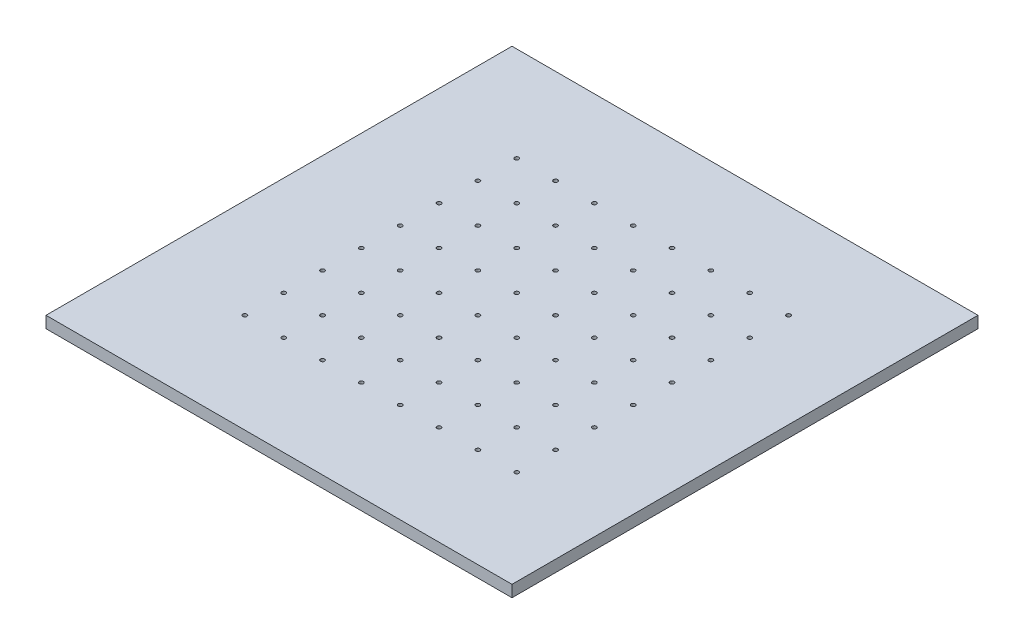
from build123d import *

# Parameters (mm, degrees)
SKETCH3_W                  = 600
SKETCH3_H                  = 600
BOSS_EXTRUDE1_DEPTH        = 15
SKETCH5_R                  = 2.65
CUT_EXTRUDE1_DEPTH         = 8.5
CUT_EXTRUDE1_DRAFT         = -1
LPATTERN1_COPY_1_SKETCH_R  = 2.65
LPATTERN1_COPY_1_DEPTH     = 8.5
LPATTERN1_COPY_1_DRAFT     = -1
LPATTERN1_COPY_2_SKETCH_R  = 2.65
LPATTERN1_COPY_2_DEPTH     = 8.5
LPATTERN1_COPY_2_DRAFT     = -1
LPATTERN1_COPY_3_SKETCH_R  = 2.65
LPATTERN1_COPY_3_DEPTH     = 8.5
LPATTERN1_COPY_3_DRAFT     = -1
LPATTERN1_COPY_4_SKETCH_R  = 2.65
LPATTERN1_COPY_4_DEPTH     = 8.5
LPATTERN1_COPY_4_DRAFT     = -1
LPATTERN1_COPY_5_SKETCH_R  = 2.65
LPATTERN1_COPY_5_DEPTH     = 8.5
LPATTERN1_COPY_5_DRAFT     = -1
LPATTERN1_COPY_6_SKETCH_R  = 2.65
LPATTERN1_COPY_6_DEPTH     = 8.5
LPATTERN1_COPY_6_DRAFT     = -1
LPATTERN1_COPY_7_SKETCH_R  = 2.65
LPATTERN1_COPY_7_DEPTH     = 8.5
LPATTERN1_COPY_7_DRAFT     = -1
LPATTERN1_COPY_8_SKETCH_R  = 2.65
LPATTERN1_COPY_8_DEPTH     = 8.5
LPATTERN1_COPY_8_DRAFT     = -1
LPATTERN1_COPY_9_SKETCH_R  = 2.65
LPATTERN1_COPY_9_DEPTH     = 8.5
LPATTERN1_COPY_9_DRAFT     = -1
LPATTERN1_COPY_10_SKETCH_R = 2.65
LPATTERN1_COPY_10_DEPTH    = 8.5
LPATTERN1_COPY_10_DRAFT    = -1
LPATTERN1_COPY_11_SKETCH_R = 2.65
LPATTERN1_COPY_11_DEPTH    = 8.5
LPATTERN1_COPY_11_DRAFT    = -1
LPATTERN1_COPY_12_SKETCH_R = 2.65
LPATTERN1_COPY_12_DEPTH    = 8.5
LPATTERN1_COPY_12_DRAFT    = -1
LPATTERN1_COPY_13_SKETCH_R = 2.65
LPATTERN1_COPY_13_DEPTH    = 8.5
LPATTERN1_COPY_13_DRAFT    = -1
LPATTERN1_COPY_14_SKETCH_R = 2.65
LPATTERN1_COPY_14_DEPTH    = 8.5
LPATTERN1_COPY_14_DRAFT    = -1
LPATTERN1_COPY_15_SKETCH_R = 2.65
LPATTERN1_COPY_15_DEPTH    = 8.5
LPATTERN1_COPY_15_DRAFT    = -1
LPATTERN1_COPY_16_SKETCH_R = 2.65
LPATTERN1_COPY_16_DEPTH    = 8.5
LPATTERN1_COPY_16_DRAFT    = -1
LPATTERN1_COPY_17_SKETCH_R = 2.65
LPATTERN1_COPY_17_DEPTH    = 8.5
LPATTERN1_COPY_17_DRAFT    = -1
LPATTERN1_COPY_18_SKETCH_R = 2.65
LPATTERN1_COPY_18_DEPTH    = 8.5
LPATTERN1_COPY_18_DRAFT    = -1
LPATTERN1_COPY_19_SKETCH_R = 2.65
LPATTERN1_COPY_19_DEPTH    = 8.5
LPATTERN1_COPY_19_DRAFT    = -1
LPATTERN1_COPY_20_SKETCH_R = 2.65
LPATTERN1_COPY_20_DEPTH    = 8.5
LPATTERN1_COPY_20_DRAFT    = -1
LPATTERN1_COPY_21_SKETCH_R = 2.65
LPATTERN1_COPY_21_DEPTH    = 8.5
LPATTERN1_COPY_21_DRAFT    = -1
LPATTERN1_COPY_22_SKETCH_R = 2.65
LPATTERN1_COPY_22_DEPTH    = 8.5
LPATTERN1_COPY_22_DRAFT    = -1
LPATTERN1_COPY_23_SKETCH_R = 2.65
LPATTERN1_COPY_23_DEPTH    = 8.5
LPATTERN1_COPY_23_DRAFT    = -1
LPATTERN1_COPY_24_SKETCH_R = 2.65
LPATTERN1_COPY_24_DEPTH    = 8.5
LPATTERN1_COPY_24_DRAFT    = -1
LPATTERN1_COPY_25_SKETCH_R = 2.65
LPATTERN1_COPY_25_DEPTH    = 8.5
LPATTERN1_COPY_25_DRAFT    = -1
LPATTERN1_COPY_26_SKETCH_R = 2.65
LPATTERN1_COPY_26_DEPTH    = 8.5
LPATTERN1_COPY_26_DRAFT    = -1
LPATTERN1_COPY_27_SKETCH_R = 2.65
LPATTERN1_COPY_27_DEPTH    = 8.5
LPATTERN1_COPY_27_DRAFT    = -1
LPATTERN1_COPY_28_SKETCH_R = 2.65
LPATTERN1_COPY_28_DEPTH    = 8.5
LPATTERN1_COPY_28_DRAFT    = -1
LPATTERN1_COPY_29_SKETCH_R = 2.65
LPATTERN1_COPY_29_DEPTH    = 8.5
LPATTERN1_COPY_29_DRAFT    = -1
LPATTERN1_COPY_30_SKETCH_R = 2.65
LPATTERN1_COPY_30_DEPTH    = 8.5
LPATTERN1_COPY_30_DRAFT    = -1
LPATTERN1_COPY_31_SKETCH_R = 2.65
LPATTERN1_COPY_31_DEPTH    = 8.5
LPATTERN1_COPY_31_DRAFT    = -1
LPATTERN1_COPY_32_SKETCH_R = 2.65
LPATTERN1_COPY_32_DEPTH    = 8.5
LPATTERN1_COPY_32_DRAFT    = -1
LPATTERN1_COPY_33_SKETCH_R = 2.65
LPATTERN1_COPY_33_DEPTH    = 8.5
LPATTERN1_COPY_33_DRAFT    = -1
LPATTERN1_COPY_34_SKETCH_R = 2.65
LPATTERN1_COPY_34_DEPTH    = 8.5
LPATTERN1_COPY_34_DRAFT    = -1
LPATTERN1_COPY_35_SKETCH_R = 2.65
LPATTERN1_COPY_35_DEPTH    = 8.5
LPATTERN1_COPY_35_DRAFT    = -1
LPATTERN1_COPY_36_SKETCH_R = 2.65
LPATTERN1_COPY_36_DEPTH    = 8.5
LPATTERN1_COPY_36_DRAFT    = -1
LPATTERN1_COPY_37_SKETCH_R = 2.65
LPATTERN1_COPY_37_DEPTH    = 8.5
LPATTERN1_COPY_37_DRAFT    = -1
LPATTERN1_COPY_38_SKETCH_R = 2.65
LPATTERN1_COPY_38_DEPTH    = 8.5
LPATTERN1_COPY_38_DRAFT    = -1
LPATTERN1_COPY_39_SKETCH_R = 2.65
LPATTERN1_COPY_39_DEPTH    = 8.5
LPATTERN1_COPY_39_DRAFT    = -1
LPATTERN1_COPY_40_SKETCH_R = 2.65
LPATTERN1_COPY_40_DEPTH    = 8.5
LPATTERN1_COPY_40_DRAFT    = -1
LPATTERN1_COPY_41_SKETCH_R = 2.65
LPATTERN1_COPY_41_DEPTH    = 8.5
LPATTERN1_COPY_41_DRAFT    = -1
LPATTERN1_COPY_42_SKETCH_R = 2.65
LPATTERN1_COPY_42_DEPTH    = 8.5
LPATTERN1_COPY_42_DRAFT    = -1
LPATTERN1_COPY_43_SKETCH_R = 2.65
LPATTERN1_COPY_43_DEPTH    = 8.5
LPATTERN1_COPY_43_DRAFT    = -1
LPATTERN1_COPY_44_SKETCH_R = 2.65
LPATTERN1_COPY_44_DEPTH    = 8.5
LPATTERN1_COPY_44_DRAFT    = -1
LPATTERN1_COPY_45_SKETCH_R = 2.65
LPATTERN1_COPY_45_DEPTH    = 8.5
LPATTERN1_COPY_45_DRAFT    = -1
LPATTERN1_COPY_46_SKETCH_R = 2.65
LPATTERN1_COPY_46_DEPTH    = 8.5
LPATTERN1_COPY_46_DRAFT    = -1
LPATTERN1_COPY_47_SKETCH_R = 2.65
LPATTERN1_COPY_47_DEPTH    = 8.5
LPATTERN1_COPY_47_DRAFT    = -1
LPATTERN1_COPY_48_SKETCH_R = 2.65
LPATTERN1_COPY_48_DEPTH    = 8.5
LPATTERN1_COPY_48_DRAFT    = -1
LPATTERN1_COPY_49_SKETCH_R = 2.65
LPATTERN1_COPY_49_DEPTH    = 8.5
LPATTERN1_COPY_49_DRAFT    = -1
LPATTERN1_COPY_50_SKETCH_R = 2.65
LPATTERN1_COPY_50_DEPTH    = 8.5
LPATTERN1_COPY_50_DRAFT    = -1
LPATTERN1_COPY_51_SKETCH_R = 2.65
LPATTERN1_COPY_51_DEPTH    = 8.5
LPATTERN1_COPY_51_DRAFT    = -1
LPATTERN1_COPY_52_SKETCH_R = 2.65
LPATTERN1_COPY_52_DEPTH    = 8.5
LPATTERN1_COPY_52_DRAFT    = -1
LPATTERN1_COPY_53_SKETCH_R = 2.65
LPATTERN1_COPY_53_DEPTH    = 8.5
LPATTERN1_COPY_53_DRAFT    = -1
LPATTERN1_COPY_54_SKETCH_R = 2.65
LPATTERN1_COPY_54_DEPTH    = 8.5
LPATTERN1_COPY_54_DRAFT    = -1
LPATTERN1_COPY_55_SKETCH_R = 2.65
LPATTERN1_COPY_55_DEPTH    = 8.5
LPATTERN1_COPY_55_DRAFT    = -1
LPATTERN1_COPY_56_SKETCH_R = 2.65
LPATTERN1_COPY_56_DEPTH    = 8.5
LPATTERN1_COPY_56_DRAFT    = -1
LPATTERN1_COPY_57_SKETCH_R = 2.65
LPATTERN1_COPY_57_DEPTH    = 8.5
LPATTERN1_COPY_57_DRAFT    = -1
LPATTERN1_COPY_58_SKETCH_R = 2.65
LPATTERN1_COPY_58_DEPTH    = 8.5
LPATTERN1_COPY_58_DRAFT    = -1
LPATTERN1_COPY_59_SKETCH_R = 2.65
LPATTERN1_COPY_59_DEPTH    = 8.5
LPATTERN1_COPY_59_DRAFT    = -1
LPATTERN1_COPY_60_SKETCH_R = 2.65
LPATTERN1_COPY_60_DEPTH    = 8.5
LPATTERN1_COPY_60_DRAFT    = -1
LPATTERN1_COPY_61_SKETCH_R = 2.65
LPATTERN1_COPY_61_DEPTH    = 8.5
LPATTERN1_COPY_61_DRAFT    = -1
LPATTERN1_COPY_62_SKETCH_R = 2.65
LPATTERN1_COPY_62_DEPTH    = 8.5
LPATTERN1_COPY_62_DRAFT    = -1
LPATTERN1_COPY_63_SKETCH_R = 2.65
LPATTERN1_COPY_63_DEPTH    = 8.5
LPATTERN1_COPY_63_DRAFT    = -1


with BuildPart() as part:
    # Sketch3 → Boss-Extrude1 (new body)
    with BuildSketch(Plane(origin=(0, 0, 0), x_dir=(1, 0, 0), z_dir=(0, 1, 0))):
        Rectangle(SKETCH3_W, SKETCH3_H)
    extrude(amount=BOSS_EXTRUDE1_DEPTH)


with BuildPart() as cut_extrude1_tool:
    # Sketch5 → Cut-Extrude1 (with draft: the straight prism first)
    with BuildSketch(Plane(origin=(0, 15, 0), x_dir=(1, 0, 0), z_dir=(0, 1, 0))):
        with Locations((178.037752637, 178)):
            Circle(SKETCH5_R)
    extrude(amount=-CUT_EXTRUDE1_DEPTH)
    # Cut-Extrude1: the draft: its side faces are tilted about the plane it starts from
    cut_extrude1_sides = [cut_extrude1_tool.faces().sort_by_distance(p)[0] for p in [
        (175.387752637, 10.75, -178),
    ]]
    draft(cut_extrude1_sides, Plane(origin=(0, 15, 0), x_dir=(1, 0, 0), z_dir=(0, 1, 0)), CUT_EXTRUDE1_DRAFT)


with BuildPart() as part_1:
    add(part.part)

    # Cut-Extrude1: cut by cut_extrude1_tool
    add(cut_extrude1_tool.part, mode=Mode.SUBTRACT)


with BuildPart() as lpattern1_copy_1_tool:
    # LPattern1 copy 1 sketch → LPattern1 copy 1 (with draft: the straight prism first)
    with BuildSketch(Plane(origin=(0, 15, 50), x_dir=(1, 0, 0), z_dir=(0, 1, 0))):
        with Locations((178.037752637, 178)):
            Circle(LPATTERN1_COPY_1_SKETCH_R)
    extrude(amount=-LPATTERN1_COPY_1_DEPTH)
    # LPattern1 copy 1: the draft: its side faces are tilted about the plane it starts from
    lpattern1_copy_1_sides = [lpattern1_copy_1_tool.faces().sort_by_distance(p)[0] for p in [
        (175.387752637, 10.75, -128),
    ]]
    draft(lpattern1_copy_1_sides, Plane(origin=(0, 15, 50), x_dir=(1, 0, 0), z_dir=(0, 1, 0)), LPATTERN1_COPY_1_DRAFT)


with BuildPart() as part_2:
    add(part_1.part)

    # LPattern1 copy 1: cut by lpattern1_copy_1_tool
    add(lpattern1_copy_1_tool.part, mode=Mode.SUBTRACT)


with BuildPart() as lpattern1_copy_2_tool:
    # LPattern1 copy 2 sketch → LPattern1 copy 2 (with draft: the straight prism first)
    with BuildSketch(Plane(origin=(0, 15, 100), x_dir=(1, 0, 0), z_dir=(0, 1, 0))):
        with Locations((178.037752637, 178)):
            Circle(LPATTERN1_COPY_2_SKETCH_R)
    extrude(amount=-LPATTERN1_COPY_2_DEPTH)
    # LPattern1 copy 2: the draft: its side faces are tilted about the plane it starts from
    lpattern1_copy_2_sides = [lpattern1_copy_2_tool.faces().sort_by_distance(p)[0] for p in [
        (175.387752637, 10.75, -78),
    ]]
    draft(lpattern1_copy_2_sides, Plane(origin=(0, 15, 100), x_dir=(1, 0, 0), z_dir=(0, 1, 0)), LPATTERN1_COPY_2_DRAFT)


with BuildPart() as part_3:
    add(part_2.part)

    # LPattern1 copy 2: cut by lpattern1_copy_2_tool
    add(lpattern1_copy_2_tool.part, mode=Mode.SUBTRACT)


with BuildPart() as lpattern1_copy_3_tool:
    # LPattern1 copy 3 sketch → LPattern1 copy 3 (with draft: the straight prism first)
    with BuildSketch(Plane(origin=(0, 15, 150), x_dir=(1, 0, 0), z_dir=(0, 1, 0))):
        with Locations((178.037752637, 178)):
            Circle(LPATTERN1_COPY_3_SKETCH_R)
    extrude(amount=-LPATTERN1_COPY_3_DEPTH)
    # LPattern1 copy 3: the draft: its side faces are tilted about the plane it starts from
    lpattern1_copy_3_sides = [lpattern1_copy_3_tool.faces().sort_by_distance(p)[0] for p in [
        (175.387752637, 10.75, -28),
    ]]
    draft(lpattern1_copy_3_sides, Plane(origin=(0, 15, 150), x_dir=(1, 0, 0), z_dir=(0, 1, 0)), LPATTERN1_COPY_3_DRAFT)


with BuildPart() as part_4:
    add(part_3.part)

    # LPattern1 copy 3: cut by lpattern1_copy_3_tool
    add(lpattern1_copy_3_tool.part, mode=Mode.SUBTRACT)


with BuildPart() as lpattern1_copy_4_tool:
    # LPattern1 copy 4 sketch → LPattern1 copy 4 (with draft: the straight prism first)
    with BuildSketch(Plane(origin=(0, 15, 200), x_dir=(1, 0, 0), z_dir=(0, 1, 0))):
        with Locations((178.037752637, 178)):
            Circle(LPATTERN1_COPY_4_SKETCH_R)
    extrude(amount=-LPATTERN1_COPY_4_DEPTH)
    # LPattern1 copy 4: the draft: its side faces are tilted about the plane it starts from
    lpattern1_copy_4_sides = [lpattern1_copy_4_tool.faces().sort_by_distance(p)[0] for p in [
        (175.387752637, 10.75, 22),
    ]]
    draft(lpattern1_copy_4_sides, Plane(origin=(0, 15, 200), x_dir=(1, 0, 0), z_dir=(0, 1, 0)), LPATTERN1_COPY_4_DRAFT)


with BuildPart() as part_5:
    add(part_4.part)

    # LPattern1 copy 4: cut by lpattern1_copy_4_tool
    add(lpattern1_copy_4_tool.part, mode=Mode.SUBTRACT)


with BuildPart() as lpattern1_copy_5_tool:
    # LPattern1 copy 5 sketch → LPattern1 copy 5 (with draft: the straight prism first)
    with BuildSketch(Plane(origin=(0, 15, 250), x_dir=(1, 0, 0), z_dir=(0, 1, 0))):
        with Locations((178.037752637, 178)):
            Circle(LPATTERN1_COPY_5_SKETCH_R)
    extrude(amount=-LPATTERN1_COPY_5_DEPTH)
    # LPattern1 copy 5: the draft: its side faces are tilted about the plane it starts from
    lpattern1_copy_5_sides = [lpattern1_copy_5_tool.faces().sort_by_distance(p)[0] for p in [
        (175.387752637, 10.75, 72),
    ]]
    draft(lpattern1_copy_5_sides, Plane(origin=(0, 15, 250), x_dir=(1, 0, 0), z_dir=(0, 1, 0)), LPATTERN1_COPY_5_DRAFT)


with BuildPart() as part_6:
    add(part_5.part)

    # LPattern1 copy 5: cut by lpattern1_copy_5_tool
    add(lpattern1_copy_5_tool.part, mode=Mode.SUBTRACT)


with BuildPart() as lpattern1_copy_6_tool:
    # LPattern1 copy 6 sketch → LPattern1 copy 6 (with draft: the straight prism first)
    with BuildSketch(Plane(origin=(0, 15, 300), x_dir=(1, 0, 0), z_dir=(0, 1, 0))):
        with Locations((178.037752637, 178)):
            Circle(LPATTERN1_COPY_6_SKETCH_R)
    extrude(amount=-LPATTERN1_COPY_6_DEPTH)
    # LPattern1 copy 6: the draft: its side faces are tilted about the plane it starts from
    lpattern1_copy_6_sides = [lpattern1_copy_6_tool.faces().sort_by_distance(p)[0] for p in [
        (175.387752637, 10.75, 122),
    ]]
    draft(lpattern1_copy_6_sides, Plane(origin=(0, 15, 300), x_dir=(1, 0, 0), z_dir=(0, 1, 0)), LPATTERN1_COPY_6_DRAFT)


with BuildPart() as part_7:
    add(part_6.part)

    # LPattern1 copy 6: cut by lpattern1_copy_6_tool
    add(lpattern1_copy_6_tool.part, mode=Mode.SUBTRACT)


with BuildPart() as lpattern1_copy_7_tool:
    # LPattern1 copy 7 sketch → LPattern1 copy 7 (with draft: the straight prism first)
    with BuildSketch(Plane(origin=(0, 15, 350), x_dir=(1, 0, 0), z_dir=(0, 1, 0))):
        with Locations((178.037752637, 178)):
            Circle(LPATTERN1_COPY_7_SKETCH_R)
    extrude(amount=-LPATTERN1_COPY_7_DEPTH)
    # LPattern1 copy 7: the draft: its side faces are tilted about the plane it starts from
    lpattern1_copy_7_sides = [lpattern1_copy_7_tool.faces().sort_by_distance(p)[0] for p in [
        (175.387752637, 10.75, 172),
    ]]
    draft(lpattern1_copy_7_sides, Plane(origin=(0, 15, 350), x_dir=(1, 0, 0), z_dir=(0, 1, 0)), LPATTERN1_COPY_7_DRAFT)


with BuildPart() as part_8:
    add(part_7.part)

    # LPattern1 copy 7: cut by lpattern1_copy_7_tool
    add(lpattern1_copy_7_tool.part, mode=Mode.SUBTRACT)


with BuildPart() as lpattern1_copy_8_tool:
    # LPattern1 copy 8 sketch → LPattern1 copy 8 (with draft: the straight prism first)
    with BuildSketch(Plane(origin=(-50, 15, 0), x_dir=(1, 0, 0), z_dir=(0, 1, 0))):
        with Locations((178.037752637, 178)):
            Circle(LPATTERN1_COPY_8_SKETCH_R)
    extrude(amount=-LPATTERN1_COPY_8_DEPTH)
    # LPattern1 copy 8: the draft: its side faces are tilted about the plane it starts from
    lpattern1_copy_8_sides = [lpattern1_copy_8_tool.faces().sort_by_distance(p)[0] for p in [
        (125.387752637, 10.75, -178),
    ]]
    draft(lpattern1_copy_8_sides, Plane(origin=(-50, 15, 0), x_dir=(1, 0, 0), z_dir=(0, 1, 0)), LPATTERN1_COPY_8_DRAFT)


with BuildPart() as part_9:
    add(part_8.part)

    # LPattern1 copy 8: cut by lpattern1_copy_8_tool
    add(lpattern1_copy_8_tool.part, mode=Mode.SUBTRACT)


with BuildPart() as lpattern1_copy_9_tool:
    # LPattern1 copy 9 sketch → LPattern1 copy 9 (with draft: the straight prism first)
    with BuildSketch(Plane(origin=(-50, 15, 50), x_dir=(1, 0, 0), z_dir=(0, 1, 0))):
        with Locations((178.037752637, 178)):
            Circle(LPATTERN1_COPY_9_SKETCH_R)
    extrude(amount=-LPATTERN1_COPY_9_DEPTH)
    # LPattern1 copy 9: the draft: its side faces are tilted about the plane it starts from
    lpattern1_copy_9_sides = [lpattern1_copy_9_tool.faces().sort_by_distance(p)[0] for p in [
        (125.387752637, 10.75, -128),
    ]]
    draft(lpattern1_copy_9_sides, Plane(origin=(-50, 15, 50), x_dir=(1, 0, 0), z_dir=(0, 1, 0)), LPATTERN1_COPY_9_DRAFT)


with BuildPart() as part_10:
    add(part_9.part)

    # LPattern1 copy 9: cut by lpattern1_copy_9_tool
    add(lpattern1_copy_9_tool.part, mode=Mode.SUBTRACT)


with BuildPart() as lpattern1_copy_10_tool:
    # LPattern1 copy 10 sketch → LPattern1 copy 10 (with draft: the straight prism first)
    with BuildSketch(Plane(origin=(-50, 15, 100), x_dir=(1, 0, 0), z_dir=(0, 1, 0))):
        with Locations((178.037752637, 178)):
            Circle(LPATTERN1_COPY_10_SKETCH_R)
    extrude(amount=-LPATTERN1_COPY_10_DEPTH)
    # LPattern1 copy 10: the draft: its side faces are tilted about the plane it starts from
    lpattern1_copy_10_sides = [lpattern1_copy_10_tool.faces().sort_by_distance(p)[0] for p in [
        (125.387752637, 10.75, -78),
    ]]
    draft(lpattern1_copy_10_sides, Plane(origin=(-50, 15, 100), x_dir=(1, 0, 0), z_dir=(0, 1, 0)), LPATTERN1_COPY_10_DRAFT)


with BuildPart() as part_11:
    add(part_10.part)

    # LPattern1 copy 10: cut by lpattern1_copy_10_tool
    add(lpattern1_copy_10_tool.part, mode=Mode.SUBTRACT)


with BuildPart() as lpattern1_copy_11_tool:
    # LPattern1 copy 11 sketch → LPattern1 copy 11 (with draft: the straight prism first)
    with BuildSketch(Plane(origin=(-50, 15, 150), x_dir=(1, 0, 0), z_dir=(0, 1, 0))):
        with Locations((178.037752637, 178)):
            Circle(LPATTERN1_COPY_11_SKETCH_R)
    extrude(amount=-LPATTERN1_COPY_11_DEPTH)
    # LPattern1 copy 11: the draft: its side faces are tilted about the plane it starts from
    lpattern1_copy_11_sides = [lpattern1_copy_11_tool.faces().sort_by_distance(p)[0] for p in [
        (125.387752637, 10.75, -28),
    ]]
    draft(lpattern1_copy_11_sides, Plane(origin=(-50, 15, 150), x_dir=(1, 0, 0), z_dir=(0, 1, 0)), LPATTERN1_COPY_11_DRAFT)


with BuildPart() as part_12:
    add(part_11.part)

    # LPattern1 copy 11: cut by lpattern1_copy_11_tool
    add(lpattern1_copy_11_tool.part, mode=Mode.SUBTRACT)


with BuildPart() as lpattern1_copy_12_tool:
    # LPattern1 copy 12 sketch → LPattern1 copy 12 (with draft: the straight prism first)
    with BuildSketch(Plane(origin=(-50, 15, 200), x_dir=(1, 0, 0), z_dir=(0, 1, 0))):
        with Locations((178.037752637, 178)):
            Circle(LPATTERN1_COPY_12_SKETCH_R)
    extrude(amount=-LPATTERN1_COPY_12_DEPTH)
    # LPattern1 copy 12: the draft: its side faces are tilted about the plane it starts from
    lpattern1_copy_12_sides = [lpattern1_copy_12_tool.faces().sort_by_distance(p)[0] for p in [
        (125.387752637, 10.75, 22),
    ]]
    draft(lpattern1_copy_12_sides, Plane(origin=(-50, 15, 200), x_dir=(1, 0, 0), z_dir=(0, 1, 0)), LPATTERN1_COPY_12_DRAFT)


with BuildPart() as part_13:
    add(part_12.part)

    # LPattern1 copy 12: cut by lpattern1_copy_12_tool
    add(lpattern1_copy_12_tool.part, mode=Mode.SUBTRACT)


with BuildPart() as lpattern1_copy_13_tool:
    # LPattern1 copy 13 sketch → LPattern1 copy 13 (with draft: the straight prism first)
    with BuildSketch(Plane(origin=(-50, 15, 250), x_dir=(1, 0, 0), z_dir=(0, 1, 0))):
        with Locations((178.037752637, 178)):
            Circle(LPATTERN1_COPY_13_SKETCH_R)
    extrude(amount=-LPATTERN1_COPY_13_DEPTH)
    # LPattern1 copy 13: the draft: its side faces are tilted about the plane it starts from
    lpattern1_copy_13_sides = [lpattern1_copy_13_tool.faces().sort_by_distance(p)[0] for p in [
        (125.387752637, 10.75, 72),
    ]]
    draft(lpattern1_copy_13_sides, Plane(origin=(-50, 15, 250), x_dir=(1, 0, 0), z_dir=(0, 1, 0)), LPATTERN1_COPY_13_DRAFT)


with BuildPart() as part_14:
    add(part_13.part)

    # LPattern1 copy 13: cut by lpattern1_copy_13_tool
    add(lpattern1_copy_13_tool.part, mode=Mode.SUBTRACT)


with BuildPart() as lpattern1_copy_14_tool:
    # LPattern1 copy 14 sketch → LPattern1 copy 14 (with draft: the straight prism first)
    with BuildSketch(Plane(origin=(-50, 15, 300), x_dir=(1, 0, 0), z_dir=(0, 1, 0))):
        with Locations((178.037752637, 178)):
            Circle(LPATTERN1_COPY_14_SKETCH_R)
    extrude(amount=-LPATTERN1_COPY_14_DEPTH)
    # LPattern1 copy 14: the draft: its side faces are tilted about the plane it starts from
    lpattern1_copy_14_sides = [lpattern1_copy_14_tool.faces().sort_by_distance(p)[0] for p in [
        (125.387752637, 10.75, 122),
    ]]
    draft(lpattern1_copy_14_sides, Plane(origin=(-50, 15, 300), x_dir=(1, 0, 0), z_dir=(0, 1, 0)), LPATTERN1_COPY_14_DRAFT)


with BuildPart() as part_15:
    add(part_14.part)

    # LPattern1 copy 14: cut by lpattern1_copy_14_tool
    add(lpattern1_copy_14_tool.part, mode=Mode.SUBTRACT)


with BuildPart() as lpattern1_copy_15_tool:
    # LPattern1 copy 15 sketch → LPattern1 copy 15 (with draft: the straight prism first)
    with BuildSketch(Plane(origin=(-50, 15, 350), x_dir=(1, 0, 0), z_dir=(0, 1, 0))):
        with Locations((178.037752637, 178)):
            Circle(LPATTERN1_COPY_15_SKETCH_R)
    extrude(amount=-LPATTERN1_COPY_15_DEPTH)
    # LPattern1 copy 15: the draft: its side faces are tilted about the plane it starts from
    lpattern1_copy_15_sides = [lpattern1_copy_15_tool.faces().sort_by_distance(p)[0] for p in [
        (125.387752637, 10.75, 172),
    ]]
    draft(lpattern1_copy_15_sides, Plane(origin=(-50, 15, 350), x_dir=(1, 0, 0), z_dir=(0, 1, 0)), LPATTERN1_COPY_15_DRAFT)


with BuildPart() as part_16:
    add(part_15.part)

    # LPattern1 copy 15: cut by lpattern1_copy_15_tool
    add(lpattern1_copy_15_tool.part, mode=Mode.SUBTRACT)


with BuildPart() as lpattern1_copy_16_tool:
    # LPattern1 copy 16 sketch → LPattern1 copy 16 (with draft: the straight prism first)
    with BuildSketch(Plane(origin=(-100, 15, 0), x_dir=(1, 0, 0), z_dir=(0, 1, 0))):
        with Locations((178.037752637, 178)):
            Circle(LPATTERN1_COPY_16_SKETCH_R)
    extrude(amount=-LPATTERN1_COPY_16_DEPTH)
    # LPattern1 copy 16: the draft: its side faces are tilted about the plane it starts from
    lpattern1_copy_16_sides = [lpattern1_copy_16_tool.faces().sort_by_distance(p)[0] for p in [
        (75.387752637, 10.75, -178),
    ]]
    draft(lpattern1_copy_16_sides, Plane(origin=(-100, 15, 0), x_dir=(1, 0, 0), z_dir=(0, 1, 0)), LPATTERN1_COPY_16_DRAFT)


with BuildPart() as part_17:
    add(part_16.part)

    # LPattern1 copy 16: cut by lpattern1_copy_16_tool
    add(lpattern1_copy_16_tool.part, mode=Mode.SUBTRACT)


with BuildPart() as lpattern1_copy_17_tool:
    # LPattern1 copy 17 sketch → LPattern1 copy 17 (with draft: the straight prism first)
    with BuildSketch(Plane(origin=(-100, 15, 50), x_dir=(1, 0, 0), z_dir=(0, 1, 0))):
        with Locations((178.037752637, 178)):
            Circle(LPATTERN1_COPY_17_SKETCH_R)
    extrude(amount=-LPATTERN1_COPY_17_DEPTH)
    # LPattern1 copy 17: the draft: its side faces are tilted about the plane it starts from
    lpattern1_copy_17_sides = [lpattern1_copy_17_tool.faces().sort_by_distance(p)[0] for p in [
        (75.387752637, 10.75, -128),
    ]]
    draft(lpattern1_copy_17_sides, Plane(origin=(-100, 15, 50), x_dir=(1, 0, 0), z_dir=(0, 1, 0)), LPATTERN1_COPY_17_DRAFT)


with BuildPart() as part_18:
    add(part_17.part)

    # LPattern1 copy 17: cut by lpattern1_copy_17_tool
    add(lpattern1_copy_17_tool.part, mode=Mode.SUBTRACT)


with BuildPart() as lpattern1_copy_18_tool:
    # LPattern1 copy 18 sketch → LPattern1 copy 18 (with draft: the straight prism first)
    with BuildSketch(Plane(origin=(-100, 15, 100), x_dir=(1, 0, 0), z_dir=(0, 1, 0))):
        with Locations((178.037752637, 178)):
            Circle(LPATTERN1_COPY_18_SKETCH_R)
    extrude(amount=-LPATTERN1_COPY_18_DEPTH)
    # LPattern1 copy 18: the draft: its side faces are tilted about the plane it starts from
    lpattern1_copy_18_sides = [lpattern1_copy_18_tool.faces().sort_by_distance(p)[0] for p in [
        (75.387752637, 10.75, -78),
    ]]
    draft(lpattern1_copy_18_sides, Plane(origin=(-100, 15, 100), x_dir=(1, 0, 0), z_dir=(0, 1, 0)), LPATTERN1_COPY_18_DRAFT)


with BuildPart() as part_19:
    add(part_18.part)

    # LPattern1 copy 18: cut by lpattern1_copy_18_tool
    add(lpattern1_copy_18_tool.part, mode=Mode.SUBTRACT)


with BuildPart() as lpattern1_copy_19_tool:
    # LPattern1 copy 19 sketch → LPattern1 copy 19 (with draft: the straight prism first)
    with BuildSketch(Plane(origin=(-100, 15, 150), x_dir=(1, 0, 0), z_dir=(0, 1, 0))):
        with Locations((178.037752637, 178)):
            Circle(LPATTERN1_COPY_19_SKETCH_R)
    extrude(amount=-LPATTERN1_COPY_19_DEPTH)
    # LPattern1 copy 19: the draft: its side faces are tilted about the plane it starts from
    lpattern1_copy_19_sides = [lpattern1_copy_19_tool.faces().sort_by_distance(p)[0] for p in [
        (75.387752637, 10.75, -28),
    ]]
    draft(lpattern1_copy_19_sides, Plane(origin=(-100, 15, 150), x_dir=(1, 0, 0), z_dir=(0, 1, 0)), LPATTERN1_COPY_19_DRAFT)


with BuildPart() as part_20:
    add(part_19.part)

    # LPattern1 copy 19: cut by lpattern1_copy_19_tool
    add(lpattern1_copy_19_tool.part, mode=Mode.SUBTRACT)


with BuildPart() as lpattern1_copy_20_tool:
    # LPattern1 copy 20 sketch → LPattern1 copy 20 (with draft: the straight prism first)
    with BuildSketch(Plane(origin=(-100, 15, 200), x_dir=(1, 0, 0), z_dir=(0, 1, 0))):
        with Locations((178.037752637, 178)):
            Circle(LPATTERN1_COPY_20_SKETCH_R)
    extrude(amount=-LPATTERN1_COPY_20_DEPTH)
    # LPattern1 copy 20: the draft: its side faces are tilted about the plane it starts from
    lpattern1_copy_20_sides = [lpattern1_copy_20_tool.faces().sort_by_distance(p)[0] for p in [
        (75.387752637, 10.75, 22),
    ]]
    draft(lpattern1_copy_20_sides, Plane(origin=(-100, 15, 200), x_dir=(1, 0, 0), z_dir=(0, 1, 0)), LPATTERN1_COPY_20_DRAFT)


with BuildPart() as part_21:
    add(part_20.part)

    # LPattern1 copy 20: cut by lpattern1_copy_20_tool
    add(lpattern1_copy_20_tool.part, mode=Mode.SUBTRACT)


with BuildPart() as lpattern1_copy_21_tool:
    # LPattern1 copy 21 sketch → LPattern1 copy 21 (with draft: the straight prism first)
    with BuildSketch(Plane(origin=(-100, 15, 250), x_dir=(1, 0, 0), z_dir=(0, 1, 0))):
        with Locations((178.037752637, 178)):
            Circle(LPATTERN1_COPY_21_SKETCH_R)
    extrude(amount=-LPATTERN1_COPY_21_DEPTH)
    # LPattern1 copy 21: the draft: its side faces are tilted about the plane it starts from
    lpattern1_copy_21_sides = [lpattern1_copy_21_tool.faces().sort_by_distance(p)[0] for p in [
        (75.387752637, 10.75, 72),
    ]]
    draft(lpattern1_copy_21_sides, Plane(origin=(-100, 15, 250), x_dir=(1, 0, 0), z_dir=(0, 1, 0)), LPATTERN1_COPY_21_DRAFT)


with BuildPart() as part_22:
    add(part_21.part)

    # LPattern1 copy 21: cut by lpattern1_copy_21_tool
    add(lpattern1_copy_21_tool.part, mode=Mode.SUBTRACT)


with BuildPart() as lpattern1_copy_22_tool:
    # LPattern1 copy 22 sketch → LPattern1 copy 22 (with draft: the straight prism first)
    with BuildSketch(Plane(origin=(-100, 15, 300), x_dir=(1, 0, 0), z_dir=(0, 1, 0))):
        with Locations((178.037752637, 178)):
            Circle(LPATTERN1_COPY_22_SKETCH_R)
    extrude(amount=-LPATTERN1_COPY_22_DEPTH)
    # LPattern1 copy 22: the draft: its side faces are tilted about the plane it starts from
    lpattern1_copy_22_sides = [lpattern1_copy_22_tool.faces().sort_by_distance(p)[0] for p in [
        (75.387752637, 10.75, 122),
    ]]
    draft(lpattern1_copy_22_sides, Plane(origin=(-100, 15, 300), x_dir=(1, 0, 0), z_dir=(0, 1, 0)), LPATTERN1_COPY_22_DRAFT)


with BuildPart() as part_23:
    add(part_22.part)

    # LPattern1 copy 22: cut by lpattern1_copy_22_tool
    add(lpattern1_copy_22_tool.part, mode=Mode.SUBTRACT)


with BuildPart() as lpattern1_copy_23_tool:
    # LPattern1 copy 23 sketch → LPattern1 copy 23 (with draft: the straight prism first)
    with BuildSketch(Plane(origin=(-100, 15, 350), x_dir=(1, 0, 0), z_dir=(0, 1, 0))):
        with Locations((178.037752637, 178)):
            Circle(LPATTERN1_COPY_23_SKETCH_R)
    extrude(amount=-LPATTERN1_COPY_23_DEPTH)
    # LPattern1 copy 23: the draft: its side faces are tilted about the plane it starts from
    lpattern1_copy_23_sides = [lpattern1_copy_23_tool.faces().sort_by_distance(p)[0] for p in [
        (75.387752637, 10.75, 172),
    ]]
    draft(lpattern1_copy_23_sides, Plane(origin=(-100, 15, 350), x_dir=(1, 0, 0), z_dir=(0, 1, 0)), LPATTERN1_COPY_23_DRAFT)


with BuildPart() as part_24:
    add(part_23.part)

    # LPattern1 copy 23: cut by lpattern1_copy_23_tool
    add(lpattern1_copy_23_tool.part, mode=Mode.SUBTRACT)


with BuildPart() as lpattern1_copy_24_tool:
    # LPattern1 copy 24 sketch → LPattern1 copy 24 (with draft: the straight prism first)
    with BuildSketch(Plane(origin=(-150, 15, 0), x_dir=(1, 0, 0), z_dir=(0, 1, 0))):
        with Locations((178.037752637, 178)):
            Circle(LPATTERN1_COPY_24_SKETCH_R)
    extrude(amount=-LPATTERN1_COPY_24_DEPTH)
    # LPattern1 copy 24: the draft: its side faces are tilted about the plane it starts from
    lpattern1_copy_24_sides = [lpattern1_copy_24_tool.faces().sort_by_distance(p)[0] for p in [
        (25.387752637, 10.75, -178),
    ]]
    draft(lpattern1_copy_24_sides, Plane(origin=(-150, 15, 0), x_dir=(1, 0, 0), z_dir=(0, 1, 0)), LPATTERN1_COPY_24_DRAFT)


with BuildPart() as part_25:
    add(part_24.part)

    # LPattern1 copy 24: cut by lpattern1_copy_24_tool
    add(lpattern1_copy_24_tool.part, mode=Mode.SUBTRACT)


with BuildPart() as lpattern1_copy_25_tool:
    # LPattern1 copy 25 sketch → LPattern1 copy 25 (with draft: the straight prism first)
    with BuildSketch(Plane(origin=(-150, 15, 50), x_dir=(1, 0, 0), z_dir=(0, 1, 0))):
        with Locations((178.037752637, 178)):
            Circle(LPATTERN1_COPY_25_SKETCH_R)
    extrude(amount=-LPATTERN1_COPY_25_DEPTH)
    # LPattern1 copy 25: the draft: its side faces are tilted about the plane it starts from
    lpattern1_copy_25_sides = [lpattern1_copy_25_tool.faces().sort_by_distance(p)[0] for p in [
        (25.387752637, 10.75, -128),
    ]]
    draft(lpattern1_copy_25_sides, Plane(origin=(-150, 15, 50), x_dir=(1, 0, 0), z_dir=(0, 1, 0)), LPATTERN1_COPY_25_DRAFT)


with BuildPart() as part_26:
    add(part_25.part)

    # LPattern1 copy 25: cut by lpattern1_copy_25_tool
    add(lpattern1_copy_25_tool.part, mode=Mode.SUBTRACT)


with BuildPart() as lpattern1_copy_26_tool:
    # LPattern1 copy 26 sketch → LPattern1 copy 26 (with draft: the straight prism first)
    with BuildSketch(Plane(origin=(-150, 15, 100), x_dir=(1, 0, 0), z_dir=(0, 1, 0))):
        with Locations((178.037752637, 178)):
            Circle(LPATTERN1_COPY_26_SKETCH_R)
    extrude(amount=-LPATTERN1_COPY_26_DEPTH)
    # LPattern1 copy 26: the draft: its side faces are tilted about the plane it starts from
    lpattern1_copy_26_sides = [lpattern1_copy_26_tool.faces().sort_by_distance(p)[0] for p in [
        (25.387752637, 10.75, -78),
    ]]
    draft(lpattern1_copy_26_sides, Plane(origin=(-150, 15, 100), x_dir=(1, 0, 0), z_dir=(0, 1, 0)), LPATTERN1_COPY_26_DRAFT)


with BuildPart() as part_27:
    add(part_26.part)

    # LPattern1 copy 26: cut by lpattern1_copy_26_tool
    add(lpattern1_copy_26_tool.part, mode=Mode.SUBTRACT)


with BuildPart() as lpattern1_copy_27_tool:
    # LPattern1 copy 27 sketch → LPattern1 copy 27 (with draft: the straight prism first)
    with BuildSketch(Plane(origin=(-150, 15, 150), x_dir=(1, 0, 0), z_dir=(0, 1, 0))):
        with Locations((178.037752637, 178)):
            Circle(LPATTERN1_COPY_27_SKETCH_R)
    extrude(amount=-LPATTERN1_COPY_27_DEPTH)
    # LPattern1 copy 27: the draft: its side faces are tilted about the plane it starts from
    lpattern1_copy_27_sides = [lpattern1_copy_27_tool.faces().sort_by_distance(p)[0] for p in [
        (25.387752637, 10.75, -28),
    ]]
    draft(lpattern1_copy_27_sides, Plane(origin=(-150, 15, 150), x_dir=(1, 0, 0), z_dir=(0, 1, 0)), LPATTERN1_COPY_27_DRAFT)


with BuildPart() as part_28:
    add(part_27.part)

    # LPattern1 copy 27: cut by lpattern1_copy_27_tool
    add(lpattern1_copy_27_tool.part, mode=Mode.SUBTRACT)


with BuildPart() as lpattern1_copy_28_tool:
    # LPattern1 copy 28 sketch → LPattern1 copy 28 (with draft: the straight prism first)
    with BuildSketch(Plane(origin=(-150, 15, 200), x_dir=(1, 0, 0), z_dir=(0, 1, 0))):
        with Locations((178.037752637, 178)):
            Circle(LPATTERN1_COPY_28_SKETCH_R)
    extrude(amount=-LPATTERN1_COPY_28_DEPTH)
    # LPattern1 copy 28: the draft: its side faces are tilted about the plane it starts from
    lpattern1_copy_28_sides = [lpattern1_copy_28_tool.faces().sort_by_distance(p)[0] for p in [
        (25.387752637, 10.75, 22),
    ]]
    draft(lpattern1_copy_28_sides, Plane(origin=(-150, 15, 200), x_dir=(1, 0, 0), z_dir=(0, 1, 0)), LPATTERN1_COPY_28_DRAFT)


with BuildPart() as part_29:
    add(part_28.part)

    # LPattern1 copy 28: cut by lpattern1_copy_28_tool
    add(lpattern1_copy_28_tool.part, mode=Mode.SUBTRACT)


with BuildPart() as lpattern1_copy_29_tool:
    # LPattern1 copy 29 sketch → LPattern1 copy 29 (with draft: the straight prism first)
    with BuildSketch(Plane(origin=(-150, 15, 250), x_dir=(1, 0, 0), z_dir=(0, 1, 0))):
        with Locations((178.037752637, 178)):
            Circle(LPATTERN1_COPY_29_SKETCH_R)
    extrude(amount=-LPATTERN1_COPY_29_DEPTH)
    # LPattern1 copy 29: the draft: its side faces are tilted about the plane it starts from
    lpattern1_copy_29_sides = [lpattern1_copy_29_tool.faces().sort_by_distance(p)[0] for p in [
        (25.387752637, 10.75, 72),
    ]]
    draft(lpattern1_copy_29_sides, Plane(origin=(-150, 15, 250), x_dir=(1, 0, 0), z_dir=(0, 1, 0)), LPATTERN1_COPY_29_DRAFT)


with BuildPart() as part_30:
    add(part_29.part)

    # LPattern1 copy 29: cut by lpattern1_copy_29_tool
    add(lpattern1_copy_29_tool.part, mode=Mode.SUBTRACT)


with BuildPart() as lpattern1_copy_30_tool:
    # LPattern1 copy 30 sketch → LPattern1 copy 30 (with draft: the straight prism first)
    with BuildSketch(Plane(origin=(-150, 15, 300), x_dir=(1, 0, 0), z_dir=(0, 1, 0))):
        with Locations((178.037752637, 178)):
            Circle(LPATTERN1_COPY_30_SKETCH_R)
    extrude(amount=-LPATTERN1_COPY_30_DEPTH)
    # LPattern1 copy 30: the draft: its side faces are tilted about the plane it starts from
    lpattern1_copy_30_sides = [lpattern1_copy_30_tool.faces().sort_by_distance(p)[0] for p in [
        (25.387752637, 10.75, 122),
    ]]
    draft(lpattern1_copy_30_sides, Plane(origin=(-150, 15, 300), x_dir=(1, 0, 0), z_dir=(0, 1, 0)), LPATTERN1_COPY_30_DRAFT)


with BuildPart() as part_31:
    add(part_30.part)

    # LPattern1 copy 30: cut by lpattern1_copy_30_tool
    add(lpattern1_copy_30_tool.part, mode=Mode.SUBTRACT)


with BuildPart() as lpattern1_copy_31_tool:
    # LPattern1 copy 31 sketch → LPattern1 copy 31 (with draft: the straight prism first)
    with BuildSketch(Plane(origin=(-150, 15, 350), x_dir=(1, 0, 0), z_dir=(0, 1, 0))):
        with Locations((178.037752637, 178)):
            Circle(LPATTERN1_COPY_31_SKETCH_R)
    extrude(amount=-LPATTERN1_COPY_31_DEPTH)
    # LPattern1 copy 31: the draft: its side faces are tilted about the plane it starts from
    lpattern1_copy_31_sides = [lpattern1_copy_31_tool.faces().sort_by_distance(p)[0] for p in [
        (25.387752637, 10.75, 172),
    ]]
    draft(lpattern1_copy_31_sides, Plane(origin=(-150, 15, 350), x_dir=(1, 0, 0), z_dir=(0, 1, 0)), LPATTERN1_COPY_31_DRAFT)


with BuildPart() as part_32:
    add(part_31.part)

    # LPattern1 copy 31: cut by lpattern1_copy_31_tool
    add(lpattern1_copy_31_tool.part, mode=Mode.SUBTRACT)


with BuildPart() as lpattern1_copy_32_tool:
    # LPattern1 copy 32 sketch → LPattern1 copy 32 (with draft: the straight prism first)
    with BuildSketch(Plane(origin=(-200, 15, 0), x_dir=(1, 0, 0), z_dir=(0, 1, 0))):
        with Locations((178.037752637, 178)):
            Circle(LPATTERN1_COPY_32_SKETCH_R)
    extrude(amount=-LPATTERN1_COPY_32_DEPTH)
    # LPattern1 copy 32: the draft: its side faces are tilted about the plane it starts from
    lpattern1_copy_32_sides = [lpattern1_copy_32_tool.faces().sort_by_distance(p)[0] for p in [
        (-24.612247363, 10.75, -178),
    ]]
    draft(lpattern1_copy_32_sides, Plane(origin=(-200, 15, 0), x_dir=(1, 0, 0), z_dir=(0, 1, 0)), LPATTERN1_COPY_32_DRAFT)


with BuildPart() as part_33:
    add(part_32.part)

    # LPattern1 copy 32: cut by lpattern1_copy_32_tool
    add(lpattern1_copy_32_tool.part, mode=Mode.SUBTRACT)


with BuildPart() as lpattern1_copy_33_tool:
    # LPattern1 copy 33 sketch → LPattern1 copy 33 (with draft: the straight prism first)
    with BuildSketch(Plane(origin=(-200, 15, 50), x_dir=(1, 0, 0), z_dir=(0, 1, 0))):
        with Locations((178.037752637, 178)):
            Circle(LPATTERN1_COPY_33_SKETCH_R)
    extrude(amount=-LPATTERN1_COPY_33_DEPTH)
    # LPattern1 copy 33: the draft: its side faces are tilted about the plane it starts from
    lpattern1_copy_33_sides = [lpattern1_copy_33_tool.faces().sort_by_distance(p)[0] for p in [
        (-24.612247363, 10.75, -128),
    ]]
    draft(lpattern1_copy_33_sides, Plane(origin=(-200, 15, 50), x_dir=(1, 0, 0), z_dir=(0, 1, 0)), LPATTERN1_COPY_33_DRAFT)


with BuildPart() as part_34:
    add(part_33.part)

    # LPattern1 copy 33: cut by lpattern1_copy_33_tool
    add(lpattern1_copy_33_tool.part, mode=Mode.SUBTRACT)


with BuildPart() as lpattern1_copy_34_tool:
    # LPattern1 copy 34 sketch → LPattern1 copy 34 (with draft: the straight prism first)
    with BuildSketch(Plane(origin=(-200, 15, 100), x_dir=(1, 0, 0), z_dir=(0, 1, 0))):
        with Locations((178.037752637, 178)):
            Circle(LPATTERN1_COPY_34_SKETCH_R)
    extrude(amount=-LPATTERN1_COPY_34_DEPTH)
    # LPattern1 copy 34: the draft: its side faces are tilted about the plane it starts from
    lpattern1_copy_34_sides = [lpattern1_copy_34_tool.faces().sort_by_distance(p)[0] for p in [
        (-24.612247363, 10.75, -78),
    ]]
    draft(lpattern1_copy_34_sides, Plane(origin=(-200, 15, 100), x_dir=(1, 0, 0), z_dir=(0, 1, 0)), LPATTERN1_COPY_34_DRAFT)


with BuildPart() as part_35:
    add(part_34.part)

    # LPattern1 copy 34: cut by lpattern1_copy_34_tool
    add(lpattern1_copy_34_tool.part, mode=Mode.SUBTRACT)


with BuildPart() as lpattern1_copy_35_tool:
    # LPattern1 copy 35 sketch → LPattern1 copy 35 (with draft: the straight prism first)
    with BuildSketch(Plane(origin=(-200, 15, 150), x_dir=(1, 0, 0), z_dir=(0, 1, 0))):
        with Locations((178.037752637, 178)):
            Circle(LPATTERN1_COPY_35_SKETCH_R)
    extrude(amount=-LPATTERN1_COPY_35_DEPTH)
    # LPattern1 copy 35: the draft: its side faces are tilted about the plane it starts from
    lpattern1_copy_35_sides = [lpattern1_copy_35_tool.faces().sort_by_distance(p)[0] for p in [
        (-24.612247363, 10.75, -28),
    ]]
    draft(lpattern1_copy_35_sides, Plane(origin=(-200, 15, 150), x_dir=(1, 0, 0), z_dir=(0, 1, 0)), LPATTERN1_COPY_35_DRAFT)


with BuildPart() as part_36:
    add(part_35.part)

    # LPattern1 copy 35: cut by lpattern1_copy_35_tool
    add(lpattern1_copy_35_tool.part, mode=Mode.SUBTRACT)


with BuildPart() as lpattern1_copy_36_tool:
    # LPattern1 copy 36 sketch → LPattern1 copy 36 (with draft: the straight prism first)
    with BuildSketch(Plane(origin=(-200, 15, 200), x_dir=(1, 0, 0), z_dir=(0, 1, 0))):
        with Locations((178.037752637, 178)):
            Circle(LPATTERN1_COPY_36_SKETCH_R)
    extrude(amount=-LPATTERN1_COPY_36_DEPTH)
    # LPattern1 copy 36: the draft: its side faces are tilted about the plane it starts from
    lpattern1_copy_36_sides = [lpattern1_copy_36_tool.faces().sort_by_distance(p)[0] for p in [
        (-24.612247363, 10.75, 22),
    ]]
    draft(lpattern1_copy_36_sides, Plane(origin=(-200, 15, 200), x_dir=(1, 0, 0), z_dir=(0, 1, 0)), LPATTERN1_COPY_36_DRAFT)


with BuildPart() as part_37:
    add(part_36.part)

    # LPattern1 copy 36: cut by lpattern1_copy_36_tool
    add(lpattern1_copy_36_tool.part, mode=Mode.SUBTRACT)


with BuildPart() as lpattern1_copy_37_tool:
    # LPattern1 copy 37 sketch → LPattern1 copy 37 (with draft: the straight prism first)
    with BuildSketch(Plane(origin=(-200, 15, 250), x_dir=(1, 0, 0), z_dir=(0, 1, 0))):
        with Locations((178.037752637, 178)):
            Circle(LPATTERN1_COPY_37_SKETCH_R)
    extrude(amount=-LPATTERN1_COPY_37_DEPTH)
    # LPattern1 copy 37: the draft: its side faces are tilted about the plane it starts from
    lpattern1_copy_37_sides = [lpattern1_copy_37_tool.faces().sort_by_distance(p)[0] for p in [
        (-24.612247363, 10.75, 72),
    ]]
    draft(lpattern1_copy_37_sides, Plane(origin=(-200, 15, 250), x_dir=(1, 0, 0), z_dir=(0, 1, 0)), LPATTERN1_COPY_37_DRAFT)


with BuildPart() as part_38:
    add(part_37.part)

    # LPattern1 copy 37: cut by lpattern1_copy_37_tool
    add(lpattern1_copy_37_tool.part, mode=Mode.SUBTRACT)


with BuildPart() as lpattern1_copy_38_tool:
    # LPattern1 copy 38 sketch → LPattern1 copy 38 (with draft: the straight prism first)
    with BuildSketch(Plane(origin=(-200, 15, 300), x_dir=(1, 0, 0), z_dir=(0, 1, 0))):
        with Locations((178.037752637, 178)):
            Circle(LPATTERN1_COPY_38_SKETCH_R)
    extrude(amount=-LPATTERN1_COPY_38_DEPTH)
    # LPattern1 copy 38: the draft: its side faces are tilted about the plane it starts from
    lpattern1_copy_38_sides = [lpattern1_copy_38_tool.faces().sort_by_distance(p)[0] for p in [
        (-24.612247363, 10.75, 122),
    ]]
    draft(lpattern1_copy_38_sides, Plane(origin=(-200, 15, 300), x_dir=(1, 0, 0), z_dir=(0, 1, 0)), LPATTERN1_COPY_38_DRAFT)


with BuildPart() as part_39:
    add(part_38.part)

    # LPattern1 copy 38: cut by lpattern1_copy_38_tool
    add(lpattern1_copy_38_tool.part, mode=Mode.SUBTRACT)


with BuildPart() as lpattern1_copy_39_tool:
    # LPattern1 copy 39 sketch → LPattern1 copy 39 (with draft: the straight prism first)
    with BuildSketch(Plane(origin=(-200, 15, 350), x_dir=(1, 0, 0), z_dir=(0, 1, 0))):
        with Locations((178.037752637, 178)):
            Circle(LPATTERN1_COPY_39_SKETCH_R)
    extrude(amount=-LPATTERN1_COPY_39_DEPTH)
    # LPattern1 copy 39: the draft: its side faces are tilted about the plane it starts from
    lpattern1_copy_39_sides = [lpattern1_copy_39_tool.faces().sort_by_distance(p)[0] for p in [
        (-24.612247363, 10.75, 172),
    ]]
    draft(lpattern1_copy_39_sides, Plane(origin=(-200, 15, 350), x_dir=(1, 0, 0), z_dir=(0, 1, 0)), LPATTERN1_COPY_39_DRAFT)


with BuildPart() as part_40:
    add(part_39.part)

    # LPattern1 copy 39: cut by lpattern1_copy_39_tool
    add(lpattern1_copy_39_tool.part, mode=Mode.SUBTRACT)


with BuildPart() as lpattern1_copy_40_tool:
    # LPattern1 copy 40 sketch → LPattern1 copy 40 (with draft: the straight prism first)
    with BuildSketch(Plane(origin=(-250, 15, 0), x_dir=(1, 0, 0), z_dir=(0, 1, 0))):
        with Locations((178.037752637, 178)):
            Circle(LPATTERN1_COPY_40_SKETCH_R)
    extrude(amount=-LPATTERN1_COPY_40_DEPTH)
    # LPattern1 copy 40: the draft: its side faces are tilted about the plane it starts from
    lpattern1_copy_40_sides = [lpattern1_copy_40_tool.faces().sort_by_distance(p)[0] for p in [
        (-74.612247363, 10.75, -178),
    ]]
    draft(lpattern1_copy_40_sides, Plane(origin=(-250, 15, 0), x_dir=(1, 0, 0), z_dir=(0, 1, 0)), LPATTERN1_COPY_40_DRAFT)


with BuildPart() as part_41:
    add(part_40.part)

    # LPattern1 copy 40: cut by lpattern1_copy_40_tool
    add(lpattern1_copy_40_tool.part, mode=Mode.SUBTRACT)


with BuildPart() as lpattern1_copy_41_tool:
    # LPattern1 copy 41 sketch → LPattern1 copy 41 (with draft: the straight prism first)
    with BuildSketch(Plane(origin=(-250, 15, 50), x_dir=(1, 0, 0), z_dir=(0, 1, 0))):
        with Locations((178.037752637, 178)):
            Circle(LPATTERN1_COPY_41_SKETCH_R)
    extrude(amount=-LPATTERN1_COPY_41_DEPTH)
    # LPattern1 copy 41: the draft: its side faces are tilted about the plane it starts from
    lpattern1_copy_41_sides = [lpattern1_copy_41_tool.faces().sort_by_distance(p)[0] for p in [
        (-74.612247363, 10.75, -128),
    ]]
    draft(lpattern1_copy_41_sides, Plane(origin=(-250, 15, 50), x_dir=(1, 0, 0), z_dir=(0, 1, 0)), LPATTERN1_COPY_41_DRAFT)


with BuildPart() as part_42:
    add(part_41.part)

    # LPattern1 copy 41: cut by lpattern1_copy_41_tool
    add(lpattern1_copy_41_tool.part, mode=Mode.SUBTRACT)


with BuildPart() as lpattern1_copy_42_tool:
    # LPattern1 copy 42 sketch → LPattern1 copy 42 (with draft: the straight prism first)
    with BuildSketch(Plane(origin=(-250, 15, 100), x_dir=(1, 0, 0), z_dir=(0, 1, 0))):
        with Locations((178.037752637, 178)):
            Circle(LPATTERN1_COPY_42_SKETCH_R)
    extrude(amount=-LPATTERN1_COPY_42_DEPTH)
    # LPattern1 copy 42: the draft: its side faces are tilted about the plane it starts from
    lpattern1_copy_42_sides = [lpattern1_copy_42_tool.faces().sort_by_distance(p)[0] for p in [
        (-74.612247363, 10.75, -78),
    ]]
    draft(lpattern1_copy_42_sides, Plane(origin=(-250, 15, 100), x_dir=(1, 0, 0), z_dir=(0, 1, 0)), LPATTERN1_COPY_42_DRAFT)


with BuildPart() as part_43:
    add(part_42.part)

    # LPattern1 copy 42: cut by lpattern1_copy_42_tool
    add(lpattern1_copy_42_tool.part, mode=Mode.SUBTRACT)


with BuildPart() as lpattern1_copy_43_tool:
    # LPattern1 copy 43 sketch → LPattern1 copy 43 (with draft: the straight prism first)
    with BuildSketch(Plane(origin=(-250, 15, 150), x_dir=(1, 0, 0), z_dir=(0, 1, 0))):
        with Locations((178.037752637, 178)):
            Circle(LPATTERN1_COPY_43_SKETCH_R)
    extrude(amount=-LPATTERN1_COPY_43_DEPTH)
    # LPattern1 copy 43: the draft: its side faces are tilted about the plane it starts from
    lpattern1_copy_43_sides = [lpattern1_copy_43_tool.faces().sort_by_distance(p)[0] for p in [
        (-74.612247363, 10.75, -28),
    ]]
    draft(lpattern1_copy_43_sides, Plane(origin=(-250, 15, 150), x_dir=(1, 0, 0), z_dir=(0, 1, 0)), LPATTERN1_COPY_43_DRAFT)


with BuildPart() as part_44:
    add(part_43.part)

    # LPattern1 copy 43: cut by lpattern1_copy_43_tool
    add(lpattern1_copy_43_tool.part, mode=Mode.SUBTRACT)


with BuildPart() as lpattern1_copy_44_tool:
    # LPattern1 copy 44 sketch → LPattern1 copy 44 (with draft: the straight prism first)
    with BuildSketch(Plane(origin=(-250, 15, 200), x_dir=(1, 0, 0), z_dir=(0, 1, 0))):
        with Locations((178.037752637, 178)):
            Circle(LPATTERN1_COPY_44_SKETCH_R)
    extrude(amount=-LPATTERN1_COPY_44_DEPTH)
    # LPattern1 copy 44: the draft: its side faces are tilted about the plane it starts from
    lpattern1_copy_44_sides = [lpattern1_copy_44_tool.faces().sort_by_distance(p)[0] for p in [
        (-74.612247363, 10.75, 22),
    ]]
    draft(lpattern1_copy_44_sides, Plane(origin=(-250, 15, 200), x_dir=(1, 0, 0), z_dir=(0, 1, 0)), LPATTERN1_COPY_44_DRAFT)


with BuildPart() as part_45:
    add(part_44.part)

    # LPattern1 copy 44: cut by lpattern1_copy_44_tool
    add(lpattern1_copy_44_tool.part, mode=Mode.SUBTRACT)


with BuildPart() as lpattern1_copy_45_tool:
    # LPattern1 copy 45 sketch → LPattern1 copy 45 (with draft: the straight prism first)
    with BuildSketch(Plane(origin=(-250, 15, 250), x_dir=(1, 0, 0), z_dir=(0, 1, 0))):
        with Locations((178.037752637, 178)):
            Circle(LPATTERN1_COPY_45_SKETCH_R)
    extrude(amount=-LPATTERN1_COPY_45_DEPTH)
    # LPattern1 copy 45: the draft: its side faces are tilted about the plane it starts from
    lpattern1_copy_45_sides = [lpattern1_copy_45_tool.faces().sort_by_distance(p)[0] for p in [
        (-74.612247363, 10.75, 72),
    ]]
    draft(lpattern1_copy_45_sides, Plane(origin=(-250, 15, 250), x_dir=(1, 0, 0), z_dir=(0, 1, 0)), LPATTERN1_COPY_45_DRAFT)


with BuildPart() as part_46:
    add(part_45.part)

    # LPattern1 copy 45: cut by lpattern1_copy_45_tool
    add(lpattern1_copy_45_tool.part, mode=Mode.SUBTRACT)


with BuildPart() as lpattern1_copy_46_tool:
    # LPattern1 copy 46 sketch → LPattern1 copy 46 (with draft: the straight prism first)
    with BuildSketch(Plane(origin=(-250, 15, 300), x_dir=(1, 0, 0), z_dir=(0, 1, 0))):
        with Locations((178.037752637, 178)):
            Circle(LPATTERN1_COPY_46_SKETCH_R)
    extrude(amount=-LPATTERN1_COPY_46_DEPTH)
    # LPattern1 copy 46: the draft: its side faces are tilted about the plane it starts from
    lpattern1_copy_46_sides = [lpattern1_copy_46_tool.faces().sort_by_distance(p)[0] for p in [
        (-74.612247363, 10.75, 122),
    ]]
    draft(lpattern1_copy_46_sides, Plane(origin=(-250, 15, 300), x_dir=(1, 0, 0), z_dir=(0, 1, 0)), LPATTERN1_COPY_46_DRAFT)


with BuildPart() as part_47:
    add(part_46.part)

    # LPattern1 copy 46: cut by lpattern1_copy_46_tool
    add(lpattern1_copy_46_tool.part, mode=Mode.SUBTRACT)


with BuildPart() as lpattern1_copy_47_tool:
    # LPattern1 copy 47 sketch → LPattern1 copy 47 (with draft: the straight prism first)
    with BuildSketch(Plane(origin=(-250, 15, 350), x_dir=(1, 0, 0), z_dir=(0, 1, 0))):
        with Locations((178.037752637, 178)):
            Circle(LPATTERN1_COPY_47_SKETCH_R)
    extrude(amount=-LPATTERN1_COPY_47_DEPTH)
    # LPattern1 copy 47: the draft: its side faces are tilted about the plane it starts from
    lpattern1_copy_47_sides = [lpattern1_copy_47_tool.faces().sort_by_distance(p)[0] for p in [
        (-74.612247363, 10.75, 172),
    ]]
    draft(lpattern1_copy_47_sides, Plane(origin=(-250, 15, 350), x_dir=(1, 0, 0), z_dir=(0, 1, 0)), LPATTERN1_COPY_47_DRAFT)


with BuildPart() as part_48:
    add(part_47.part)

    # LPattern1 copy 47: cut by lpattern1_copy_47_tool
    add(lpattern1_copy_47_tool.part, mode=Mode.SUBTRACT)


with BuildPart() as lpattern1_copy_48_tool:
    # LPattern1 copy 48 sketch → LPattern1 copy 48 (with draft: the straight prism first)
    with BuildSketch(Plane(origin=(-300, 15, 0), x_dir=(1, 0, 0), z_dir=(0, 1, 0))):
        with Locations((178.037752637, 178)):
            Circle(LPATTERN1_COPY_48_SKETCH_R)
    extrude(amount=-LPATTERN1_COPY_48_DEPTH)
    # LPattern1 copy 48: the draft: its side faces are tilted about the plane it starts from
    lpattern1_copy_48_sides = [lpattern1_copy_48_tool.faces().sort_by_distance(p)[0] for p in [
        (-124.612247363, 10.75, -178),
    ]]
    draft(lpattern1_copy_48_sides, Plane(origin=(-300, 15, 0), x_dir=(1, 0, 0), z_dir=(0, 1, 0)), LPATTERN1_COPY_48_DRAFT)


with BuildPart() as part_49:
    add(part_48.part)

    # LPattern1 copy 48: cut by lpattern1_copy_48_tool
    add(lpattern1_copy_48_tool.part, mode=Mode.SUBTRACT)


with BuildPart() as lpattern1_copy_49_tool:
    # LPattern1 copy 49 sketch → LPattern1 copy 49 (with draft: the straight prism first)
    with BuildSketch(Plane(origin=(-300, 15, 50), x_dir=(1, 0, 0), z_dir=(0, 1, 0))):
        with Locations((178.037752637, 178)):
            Circle(LPATTERN1_COPY_49_SKETCH_R)
    extrude(amount=-LPATTERN1_COPY_49_DEPTH)
    # LPattern1 copy 49: the draft: its side faces are tilted about the plane it starts from
    lpattern1_copy_49_sides = [lpattern1_copy_49_tool.faces().sort_by_distance(p)[0] for p in [
        (-124.612247363, 10.75, -128),
    ]]
    draft(lpattern1_copy_49_sides, Plane(origin=(-300, 15, 50), x_dir=(1, 0, 0), z_dir=(0, 1, 0)), LPATTERN1_COPY_49_DRAFT)


with BuildPart() as part_50:
    add(part_49.part)

    # LPattern1 copy 49: cut by lpattern1_copy_49_tool
    add(lpattern1_copy_49_tool.part, mode=Mode.SUBTRACT)


with BuildPart() as lpattern1_copy_50_tool:
    # LPattern1 copy 50 sketch → LPattern1 copy 50 (with draft: the straight prism first)
    with BuildSketch(Plane(origin=(-300, 15, 100), x_dir=(1, 0, 0), z_dir=(0, 1, 0))):
        with Locations((178.037752637, 178)):
            Circle(LPATTERN1_COPY_50_SKETCH_R)
    extrude(amount=-LPATTERN1_COPY_50_DEPTH)
    # LPattern1 copy 50: the draft: its side faces are tilted about the plane it starts from
    lpattern1_copy_50_sides = [lpattern1_copy_50_tool.faces().sort_by_distance(p)[0] for p in [
        (-124.612247363, 10.75, -78),
    ]]
    draft(lpattern1_copy_50_sides, Plane(origin=(-300, 15, 100), x_dir=(1, 0, 0), z_dir=(0, 1, 0)), LPATTERN1_COPY_50_DRAFT)


with BuildPart() as part_51:
    add(part_50.part)

    # LPattern1 copy 50: cut by lpattern1_copy_50_tool
    add(lpattern1_copy_50_tool.part, mode=Mode.SUBTRACT)


with BuildPart() as lpattern1_copy_51_tool:
    # LPattern1 copy 51 sketch → LPattern1 copy 51 (with draft: the straight prism first)
    with BuildSketch(Plane(origin=(-300, 15, 150), x_dir=(1, 0, 0), z_dir=(0, 1, 0))):
        with Locations((178.037752637, 178)):
            Circle(LPATTERN1_COPY_51_SKETCH_R)
    extrude(amount=-LPATTERN1_COPY_51_DEPTH)
    # LPattern1 copy 51: the draft: its side faces are tilted about the plane it starts from
    lpattern1_copy_51_sides = [lpattern1_copy_51_tool.faces().sort_by_distance(p)[0] for p in [
        (-124.612247363, 10.75, -28),
    ]]
    draft(lpattern1_copy_51_sides, Plane(origin=(-300, 15, 150), x_dir=(1, 0, 0), z_dir=(0, 1, 0)), LPATTERN1_COPY_51_DRAFT)


with BuildPart() as part_52:
    add(part_51.part)

    # LPattern1 copy 51: cut by lpattern1_copy_51_tool
    add(lpattern1_copy_51_tool.part, mode=Mode.SUBTRACT)


with BuildPart() as lpattern1_copy_52_tool:
    # LPattern1 copy 52 sketch → LPattern1 copy 52 (with draft: the straight prism first)
    with BuildSketch(Plane(origin=(-300, 15, 200), x_dir=(1, 0, 0), z_dir=(0, 1, 0))):
        with Locations((178.037752637, 178)):
            Circle(LPATTERN1_COPY_52_SKETCH_R)
    extrude(amount=-LPATTERN1_COPY_52_DEPTH)
    # LPattern1 copy 52: the draft: its side faces are tilted about the plane it starts from
    lpattern1_copy_52_sides = [lpattern1_copy_52_tool.faces().sort_by_distance(p)[0] for p in [
        (-124.612247363, 10.75, 22),
    ]]
    draft(lpattern1_copy_52_sides, Plane(origin=(-300, 15, 200), x_dir=(1, 0, 0), z_dir=(0, 1, 0)), LPATTERN1_COPY_52_DRAFT)


with BuildPart() as part_53:
    add(part_52.part)

    # LPattern1 copy 52: cut by lpattern1_copy_52_tool
    add(lpattern1_copy_52_tool.part, mode=Mode.SUBTRACT)


with BuildPart() as lpattern1_copy_53_tool:
    # LPattern1 copy 53 sketch → LPattern1 copy 53 (with draft: the straight prism first)
    with BuildSketch(Plane(origin=(-300, 15, 250), x_dir=(1, 0, 0), z_dir=(0, 1, 0))):
        with Locations((178.037752637, 178)):
            Circle(LPATTERN1_COPY_53_SKETCH_R)
    extrude(amount=-LPATTERN1_COPY_53_DEPTH)
    # LPattern1 copy 53: the draft: its side faces are tilted about the plane it starts from
    lpattern1_copy_53_sides = [lpattern1_copy_53_tool.faces().sort_by_distance(p)[0] for p in [
        (-124.612247363, 10.75, 72),
    ]]
    draft(lpattern1_copy_53_sides, Plane(origin=(-300, 15, 250), x_dir=(1, 0, 0), z_dir=(0, 1, 0)), LPATTERN1_COPY_53_DRAFT)


with BuildPart() as part_54:
    add(part_53.part)

    # LPattern1 copy 53: cut by lpattern1_copy_53_tool
    add(lpattern1_copy_53_tool.part, mode=Mode.SUBTRACT)


with BuildPart() as lpattern1_copy_54_tool:
    # LPattern1 copy 54 sketch → LPattern1 copy 54 (with draft: the straight prism first)
    with BuildSketch(Plane(origin=(-300, 15, 300), x_dir=(1, 0, 0), z_dir=(0, 1, 0))):
        with Locations((178.037752637, 178)):
            Circle(LPATTERN1_COPY_54_SKETCH_R)
    extrude(amount=-LPATTERN1_COPY_54_DEPTH)
    # LPattern1 copy 54: the draft: its side faces are tilted about the plane it starts from
    lpattern1_copy_54_sides = [lpattern1_copy_54_tool.faces().sort_by_distance(p)[0] for p in [
        (-124.612247363, 10.75, 122),
    ]]
    draft(lpattern1_copy_54_sides, Plane(origin=(-300, 15, 300), x_dir=(1, 0, 0), z_dir=(0, 1, 0)), LPATTERN1_COPY_54_DRAFT)


with BuildPart() as part_55:
    add(part_54.part)

    # LPattern1 copy 54: cut by lpattern1_copy_54_tool
    add(lpattern1_copy_54_tool.part, mode=Mode.SUBTRACT)


with BuildPart() as lpattern1_copy_55_tool:
    # LPattern1 copy 55 sketch → LPattern1 copy 55 (with draft: the straight prism first)
    with BuildSketch(Plane(origin=(-300, 15, 350), x_dir=(1, 0, 0), z_dir=(0, 1, 0))):
        with Locations((178.037752637, 178)):
            Circle(LPATTERN1_COPY_55_SKETCH_R)
    extrude(amount=-LPATTERN1_COPY_55_DEPTH)
    # LPattern1 copy 55: the draft: its side faces are tilted about the plane it starts from
    lpattern1_copy_55_sides = [lpattern1_copy_55_tool.faces().sort_by_distance(p)[0] for p in [
        (-124.612247363, 10.75, 172),
    ]]
    draft(lpattern1_copy_55_sides, Plane(origin=(-300, 15, 350), x_dir=(1, 0, 0), z_dir=(0, 1, 0)), LPATTERN1_COPY_55_DRAFT)


with BuildPart() as part_56:
    add(part_55.part)

    # LPattern1 copy 55: cut by lpattern1_copy_55_tool
    add(lpattern1_copy_55_tool.part, mode=Mode.SUBTRACT)


with BuildPart() as lpattern1_copy_56_tool:
    # LPattern1 copy 56 sketch → LPattern1 copy 56 (with draft: the straight prism first)
    with BuildSketch(Plane(origin=(-350, 15, 0), x_dir=(1, 0, 0), z_dir=(0, 1, 0))):
        with Locations((178.037752637, 178)):
            Circle(LPATTERN1_COPY_56_SKETCH_R)
    extrude(amount=-LPATTERN1_COPY_56_DEPTH)
    # LPattern1 copy 56: the draft: its side faces are tilted about the plane it starts from
    lpattern1_copy_56_sides = [lpattern1_copy_56_tool.faces().sort_by_distance(p)[0] for p in [
        (-174.612247363, 10.75, -178),
    ]]
    draft(lpattern1_copy_56_sides, Plane(origin=(-350, 15, 0), x_dir=(1, 0, 0), z_dir=(0, 1, 0)), LPATTERN1_COPY_56_DRAFT)


with BuildPart() as part_57:
    add(part_56.part)

    # LPattern1 copy 56: cut by lpattern1_copy_56_tool
    add(lpattern1_copy_56_tool.part, mode=Mode.SUBTRACT)


with BuildPart() as lpattern1_copy_57_tool:
    # LPattern1 copy 57 sketch → LPattern1 copy 57 (with draft: the straight prism first)
    with BuildSketch(Plane(origin=(-350, 15, 50), x_dir=(1, 0, 0), z_dir=(0, 1, 0))):
        with Locations((178.037752637, 178)):
            Circle(LPATTERN1_COPY_57_SKETCH_R)
    extrude(amount=-LPATTERN1_COPY_57_DEPTH)
    # LPattern1 copy 57: the draft: its side faces are tilted about the plane it starts from
    lpattern1_copy_57_sides = [lpattern1_copy_57_tool.faces().sort_by_distance(p)[0] for p in [
        (-174.612247363, 10.75, -128),
    ]]
    draft(lpattern1_copy_57_sides, Plane(origin=(-350, 15, 50), x_dir=(1, 0, 0), z_dir=(0, 1, 0)), LPATTERN1_COPY_57_DRAFT)


with BuildPart() as part_58:
    add(part_57.part)

    # LPattern1 copy 57: cut by lpattern1_copy_57_tool
    add(lpattern1_copy_57_tool.part, mode=Mode.SUBTRACT)


with BuildPart() as lpattern1_copy_58_tool:
    # LPattern1 copy 58 sketch → LPattern1 copy 58 (with draft: the straight prism first)
    with BuildSketch(Plane(origin=(-350, 15, 100), x_dir=(1, 0, 0), z_dir=(0, 1, 0))):
        with Locations((178.037752637, 178)):
            Circle(LPATTERN1_COPY_58_SKETCH_R)
    extrude(amount=-LPATTERN1_COPY_58_DEPTH)
    # LPattern1 copy 58: the draft: its side faces are tilted about the plane it starts from
    lpattern1_copy_58_sides = [lpattern1_copy_58_tool.faces().sort_by_distance(p)[0] for p in [
        (-174.612247363, 10.75, -78),
    ]]
    draft(lpattern1_copy_58_sides, Plane(origin=(-350, 15, 100), x_dir=(1, 0, 0), z_dir=(0, 1, 0)), LPATTERN1_COPY_58_DRAFT)


with BuildPart() as part_59:
    add(part_58.part)

    # LPattern1 copy 58: cut by lpattern1_copy_58_tool
    add(lpattern1_copy_58_tool.part, mode=Mode.SUBTRACT)


with BuildPart() as lpattern1_copy_59_tool:
    # LPattern1 copy 59 sketch → LPattern1 copy 59 (with draft: the straight prism first)
    with BuildSketch(Plane(origin=(-350, 15, 150), x_dir=(1, 0, 0), z_dir=(0, 1, 0))):
        with Locations((178.037752637, 178)):
            Circle(LPATTERN1_COPY_59_SKETCH_R)
    extrude(amount=-LPATTERN1_COPY_59_DEPTH)
    # LPattern1 copy 59: the draft: its side faces are tilted about the plane it starts from
    lpattern1_copy_59_sides = [lpattern1_copy_59_tool.faces().sort_by_distance(p)[0] for p in [
        (-174.612247363, 10.75, -28),
    ]]
    draft(lpattern1_copy_59_sides, Plane(origin=(-350, 15, 150), x_dir=(1, 0, 0), z_dir=(0, 1, 0)), LPATTERN1_COPY_59_DRAFT)


with BuildPart() as part_60:
    add(part_59.part)

    # LPattern1 copy 59: cut by lpattern1_copy_59_tool
    add(lpattern1_copy_59_tool.part, mode=Mode.SUBTRACT)


with BuildPart() as lpattern1_copy_60_tool:
    # LPattern1 copy 60 sketch → LPattern1 copy 60 (with draft: the straight prism first)
    with BuildSketch(Plane(origin=(-350, 15, 200), x_dir=(1, 0, 0), z_dir=(0, 1, 0))):
        with Locations((178.037752637, 178)):
            Circle(LPATTERN1_COPY_60_SKETCH_R)
    extrude(amount=-LPATTERN1_COPY_60_DEPTH)
    # LPattern1 copy 60: the draft: its side faces are tilted about the plane it starts from
    lpattern1_copy_60_sides = [lpattern1_copy_60_tool.faces().sort_by_distance(p)[0] for p in [
        (-174.612247363, 10.75, 22),
    ]]
    draft(lpattern1_copy_60_sides, Plane(origin=(-350, 15, 200), x_dir=(1, 0, 0), z_dir=(0, 1, 0)), LPATTERN1_COPY_60_DRAFT)


with BuildPart() as part_61:
    add(part_60.part)

    # LPattern1 copy 60: cut by lpattern1_copy_60_tool
    add(lpattern1_copy_60_tool.part, mode=Mode.SUBTRACT)


with BuildPart() as lpattern1_copy_61_tool:
    # LPattern1 copy 61 sketch → LPattern1 copy 61 (with draft: the straight prism first)
    with BuildSketch(Plane(origin=(-350, 15, 250), x_dir=(1, 0, 0), z_dir=(0, 1, 0))):
        with Locations((178.037752637, 178)):
            Circle(LPATTERN1_COPY_61_SKETCH_R)
    extrude(amount=-LPATTERN1_COPY_61_DEPTH)
    # LPattern1 copy 61: the draft: its side faces are tilted about the plane it starts from
    lpattern1_copy_61_sides = [lpattern1_copy_61_tool.faces().sort_by_distance(p)[0] for p in [
        (-174.612247363, 10.75, 72),
    ]]
    draft(lpattern1_copy_61_sides, Plane(origin=(-350, 15, 250), x_dir=(1, 0, 0), z_dir=(0, 1, 0)), LPATTERN1_COPY_61_DRAFT)


with BuildPart() as part_62:
    add(part_61.part)

    # LPattern1 copy 61: cut by lpattern1_copy_61_tool
    add(lpattern1_copy_61_tool.part, mode=Mode.SUBTRACT)


with BuildPart() as lpattern1_copy_62_tool:
    # LPattern1 copy 62 sketch → LPattern1 copy 62 (with draft: the straight prism first)
    with BuildSketch(Plane(origin=(-350, 15, 300), x_dir=(1, 0, 0), z_dir=(0, 1, 0))):
        with Locations((178.037752637, 178)):
            Circle(LPATTERN1_COPY_62_SKETCH_R)
    extrude(amount=-LPATTERN1_COPY_62_DEPTH)
    # LPattern1 copy 62: the draft: its side faces are tilted about the plane it starts from
    lpattern1_copy_62_sides = [lpattern1_copy_62_tool.faces().sort_by_distance(p)[0] for p in [
        (-174.612247363, 10.75, 122),
    ]]
    draft(lpattern1_copy_62_sides, Plane(origin=(-350, 15, 300), x_dir=(1, 0, 0), z_dir=(0, 1, 0)), LPATTERN1_COPY_62_DRAFT)


with BuildPart() as part_63:
    add(part_62.part)

    # LPattern1 copy 62: cut by lpattern1_copy_62_tool
    add(lpattern1_copy_62_tool.part, mode=Mode.SUBTRACT)


with BuildPart() as lpattern1_copy_63_tool:
    # LPattern1 copy 63 sketch → LPattern1 copy 63 (with draft: the straight prism first)
    with BuildSketch(Plane(origin=(-350, 15, 350), x_dir=(1, 0, 0), z_dir=(0, 1, 0))):
        with Locations((178.037752637, 178)):
            Circle(LPATTERN1_COPY_63_SKETCH_R)
    extrude(amount=-LPATTERN1_COPY_63_DEPTH)
    # LPattern1 copy 63: the draft: its side faces are tilted about the plane it starts from
    lpattern1_copy_63_sides = [lpattern1_copy_63_tool.faces().sort_by_distance(p)[0] for p in [
        (-174.612247363, 10.75, 172),
    ]]
    draft(lpattern1_copy_63_sides, Plane(origin=(-350, 15, 350), x_dir=(1, 0, 0), z_dir=(0, 1, 0)), LPATTERN1_COPY_63_DRAFT)


with BuildPart() as part_64:
    add(part_63.part)

    # LPattern1 copy 63: cut by lpattern1_copy_63_tool
    add(lpattern1_copy_63_tool.part, mode=Mode.SUBTRACT)


solid = part_64.part
